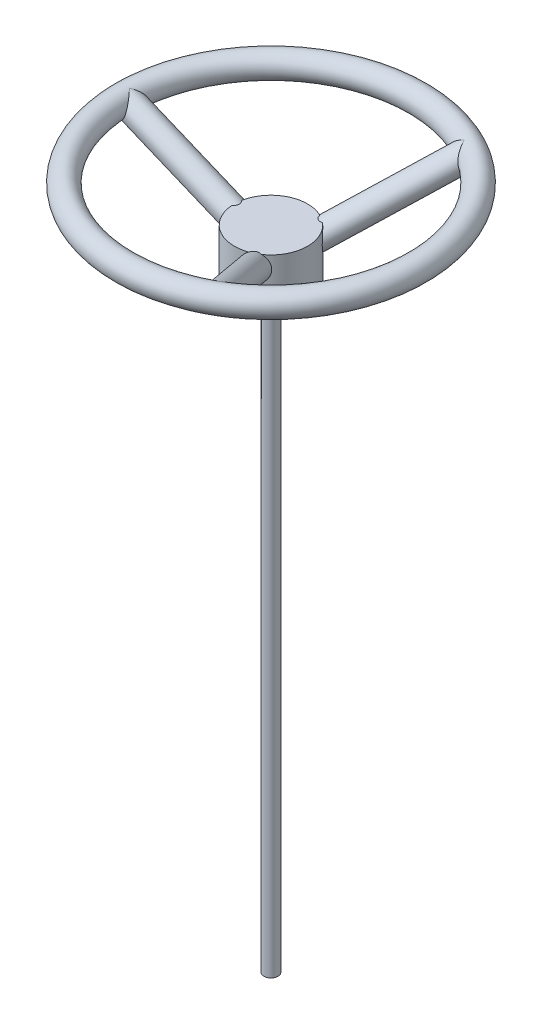
from build123d import *

# Parameters (mm, degrees)
SKETCH1_R           = 12.7
SKETCH4_R           = 38.1
BOSS_EXTRUDE1_DEPTH = 50.8
SWEEP1_PROFILE_R    = 12.7
SKETCH13_R          = 12.7
BOSS_EXTRUDE2_DEPTH = 50.8
CIRPATTERN1_COUNT   = 3
SKETCH20_R          = 7.3025
BOSS_EXTRUDE3_DEPTH = 622.3


with BuildPart() as part:
    # Sketch1 → Revolve1 (revolve)
    with BuildSketch(Plane.XY):
        Circle(SKETCH1_R)
    revolve(axis=Axis((152.4, -24.171508172, 0), (0, 1, 0)))



with BuildPart() as body_2:
    # Sketch4 → Boss-Extrude1 (new body)
    with BuildSketch(Plane(origin=(0, -38.1, 0), x_dir=(1, 0, 0), z_dir=(0, 1, 0))):
        with Locations((152.4, 0)):
            Circle(SKETCH4_R)
    extrude(amount=-BOSS_EXTRUDE1_DEPTH)


with BuildPart() as part_1:
    add(part.part)

    add(body_2.part)  # Sweep1 merges body 2
    # Sweep1: sweep along a curve in space
    with BuildLine() as sweep1_path:
        Line((114.368989505, -50.8, -2.291776762), (0, 0, 0))
    # Sweep1 profile (on start of the path) → Sweep1 (sweep)
    with BuildSketch(Plane(origin=(114.368989505, -50.8, -2.291776762), x_dir=(-0.4059338560019131, -0.9139024589918872, 0), z_dir=(-0.9137492485462624, 0.4058658035458109, 0.01831011450685407))):
        Circle(SWEEP1_PROFILE_R)
    sweep1 = sweep(path=sweep1_path.line)

    # Sketch13 → Boss-Extrude2 (add)
    with BuildSketch(Plane(origin=(114.368989505, -50.8, -2.291776762), x_dir=(-0.016733658672236966, 0.007432695385603842, -0.9998323558010842), z_dir=(0.9137492485462625, -0.40586580354581087, -0.01831011450685408))):
        Circle(SKETCH13_R)
    boss_extrude2 = extrude(amount=BOSS_EXTRUDE2_DEPTH)

    # CirPattern1: Sweep1, Boss-Extrude2 ×3 about axis
    cirpattern1_axis = Axis((152.4, -38.1, 0), (0, 1, 0))
    add([sweep1.rotate(cirpattern1_axis, i * 360 / CIRPATTERN1_COUNT) for i in range(1, CIRPATTERN1_COUNT)])
    add([boss_extrude2.rotate(cirpattern1_axis, i * 360 / CIRPATTERN1_COUNT) for i in range(1, CIRPATTERN1_COUNT)])

    # Sketch20 → Boss-Extrude3 (add)
    with BuildSketch(Plane(origin=(0, -88.9, 0), x_dir=(-1, 0, 0), z_dir=(0, -1, 0))):
        with Locations((-152.4, 0)):
            Circle(SKETCH20_R)
    extrude(amount=BOSS_EXTRUDE3_DEPTH)


solid = part_1.part
